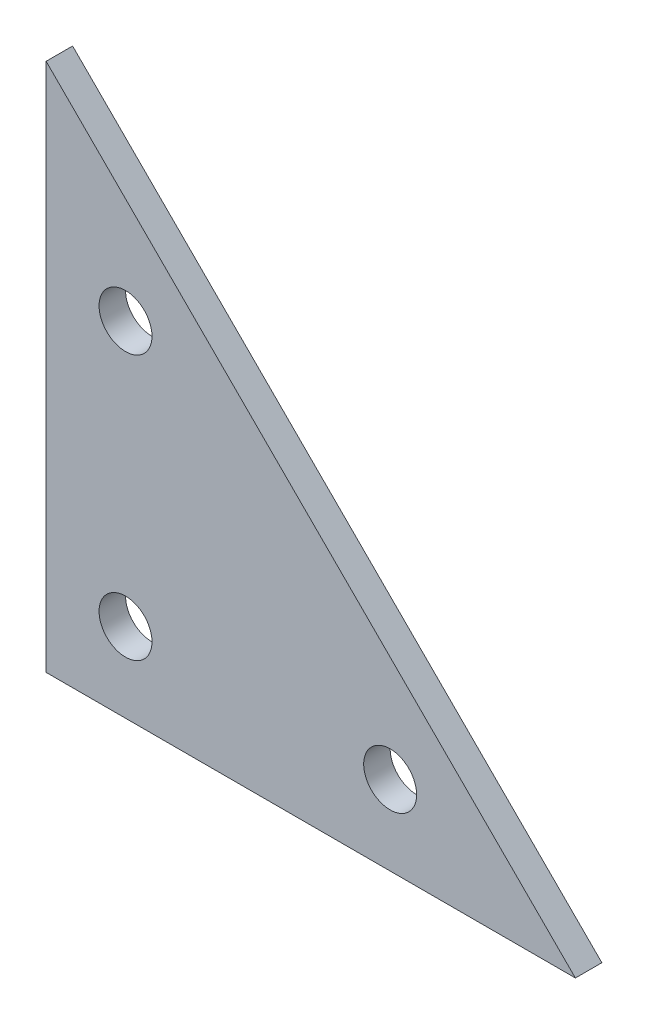
from build123d import *

# Parameters (mm, degrees)
BOSS_EXTRUDE1_DEPTH = 5
SKETCH2_R           = 5
CUT_EXTRUDE1_DEPTH  = 20


with BuildPart() as part:
    # Sketch1 → Boss-Extrude1 (new body)
    with BuildSketch(Plane.XY):
        Polygon((0, 0), (100, 0), (0, 100), align=None)
    extrude(amount=BOSS_EXTRUDE1_DEPTH)

    # Sketch2 → Cut-Extrude1 (cut)
    with BuildSketch(Plane.XY.offset(5)):
        with Locations((15, 65)):
            Circle(SKETCH2_R)
        with Locations((15, 15)):
            Circle(SKETCH2_R)
        with Locations((65, 15)):
            Circle(SKETCH2_R)
    extrude(amount=-CUT_EXTRUDE1_DEPTH, mode=Mode.SUBTRACT)


solid = part.part
